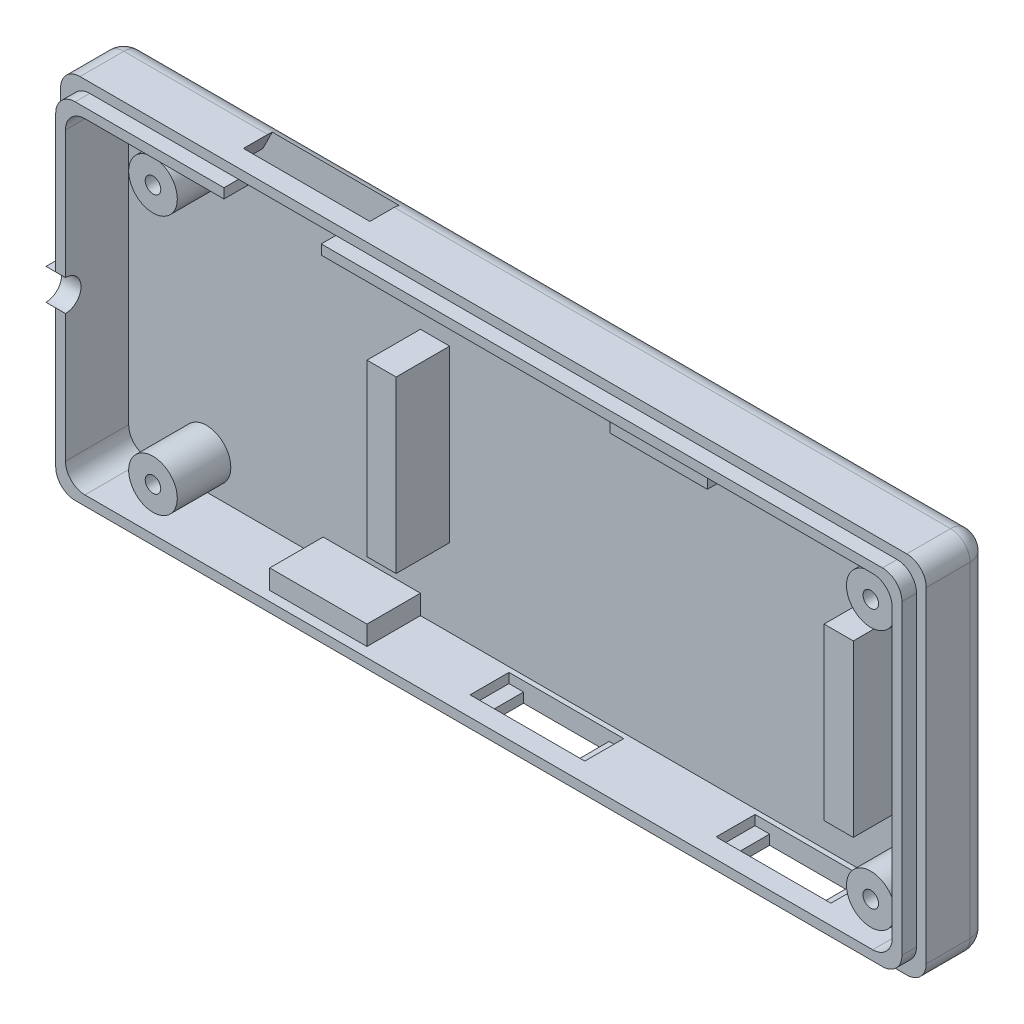
from build123d import *

# Parameters (mm, degrees)
SKETCH_1_W           = 89
SKETCH_1_H           = 37.5
EXTRUDE_1_DEPTH      = 8
SKETCH_2_W           = 85
SKETCH_2_H           = 33.5
CUT_EXTRUDE_1_DEPTH  = 6.5
FILLET_2_R           = 2
FILLET_3_R           = 2
FILLET_4_R           = 2
FILLET_5_R           = 2
FILLET_6_R           = 2
FILLET_7_R           = 2
SKETCH_3_R           = 2.5
SKETCH_3_W           = 10
SKETCH_3_H           = 2
SKETCH_3_W_2         = 3
SKETCH_3_H_2         = 17.5
EXTRUDE_2_DEPTH      = 5.5
SKETCH_4_R           = 0.8
CUT_EXTRUDE_2_DEPTH  = 97.831038412
SKETCH_5_R           = 0.8
CUT_EXTRUDE_3_DEPTH  = 97.831038412
SKETCH_6_R           = 0.8
CUT_EXTRUDE_4_DEPTH  = 97.831038412
SKETCH_8_R           = 0.8
CUT_EXTRUDE_5_DEPTH  = 97.831038412
SKETCH_9_R           = 2
CUT_EXTRUDE_6_DEPTH  = 1
CUT_EXTRUDE_7_DEPTH  = 2
SKETCH_11_W          = 8.8
SKETCH_11_H          = 4
CUT_EXTRUDE_8_DEPTH  = 2
SKETCH_12_W          = 11.8
SKETCH_12_H          = 4
CUT_EXTRUDE_9_DEPTH  = 1
CUT_EXTRUDE_10_DEPTH = 6.5
EXTRUDE_3_DEPTH      = 3.5
CUT_EXTRUDE_START    = -1.5
CUT_EXTRUDE_12_DEPTH = 1.5
SKETCH_18_W          = 10
SKETCH_18_H          = 3.5
CUT_EXTRUDE_15_DEPTH = 1


with BuildPart() as part:
    # 草图1 → 凸台-拉伸1 (new body)
    with BuildSketch(Plane.XY):
        with Locations((44.5, -18.75)):
            Rectangle(SKETCH_1_W, SKETCH_1_H)
    extrude(amount=EXTRUDE_1_DEPTH)

    # 草图2 → 切除-拉伸1 (cut)
    with BuildSketch(Plane.XY.offset(8)):
        with Locations((44.5, -18.75)):
            Rectangle(SKETCH_2_W, SKETCH_2_H)
    extrude(amount=-CUT_EXTRUDE_1_DEPTH, mode=Mode.SUBTRACT)

    # 圆角2
    fillet_2_edges = [part.edges().sort_by_distance(p)[0] for p in [
        (44.5, 0, 0),
        (89, -18.75, 0),
        (44.5, -37.5, 0),
        (0, -18.75, 0),
    ]]
    fillet(fillet_2_edges, radius=FILLET_2_R)

    # 圆角3
    fillet_3_edges = [part.edges().sort_by_distance(p)[0] for p in [
        (87, -35.5, 4.75),
    ]]
    fillet(fillet_3_edges, radius=FILLET_3_R)

    # 圆角4
    fillet_4_edges = [part.edges().sort_by_distance(p)[0] for p in [
        (87, -2, 4.75),
    ]]
    fillet(fillet_4_edges, radius=FILLET_4_R)

    # 圆角5
    fillet_5_edges = [part.edges().sort_by_distance(p)[0] for p in [
        (2, -35.5, 4.75),
    ]]
    fillet(fillet_5_edges, radius=FILLET_5_R)

    # 圆角6
    fillet_6_edges = [part.edges().sort_by_distance(p)[0] for p in [
        (2, -2, 4.75),
    ]]
    fillet(fillet_6_edges, radius=FILLET_6_R)

    # 圆角7
    # the kernel refuses this fillet: 2 mm, written as the material it takes off along each edge
    with BuildSketch(Plane(origin=(2, -2, 2), x_dir=(-1, 0, 0), z_dir=(0, 1, 0))) as fillet_7_piece_1_section:
        Polygon((0, 0), (FILLET_7_R, 0), (FILLET_7_R, -FILLET_7_R), (0, -FILLET_7_R), align=None)
    fillet_7_piece_1 = extrude(amount=FILLET_7_R, mode=Mode.PRIVATE)
    fillet_7_piece_1 = fillet_7_piece_1 - Plane(origin=(2, -2, 2), x_dir=(0.7071067811865475, 0, 0.7071067811865475), z_dir=(0, 1, 0)) * Sphere(FILLET_7_R, mode=Mode.PRIVATE)
    add(fillet_7_piece_1, mode=Mode.SUBTRACT)
    with BuildSketch(Plane(origin=(87, -2, 2), x_dir=(1, 0, 0), z_dir=(0, 1, 0))) as fillet_7_piece_2_section:
        Polygon((0, 0), (FILLET_7_R, 0), (FILLET_7_R, FILLET_7_R), (0, FILLET_7_R), align=None)
    fillet_7_piece_2 = extrude(amount=FILLET_7_R, mode=Mode.PRIVATE)
    fillet_7_piece_2 = fillet_7_piece_2 - Plane(origin=(87, -2, 2), x_dir=(-0.7071067811865475, 0, 0.7071067811865475), z_dir=(0, 1, 0)) * Sphere(FILLET_7_R, mode=Mode.PRIVATE)
    add(fillet_7_piece_2, mode=Mode.SUBTRACT)
    with BuildSketch(Plane(origin=(2, -35.5, 2), x_dir=(0, -1, 0), z_dir=(-1, 0, 0))) as fillet_7_piece_3_section:
        Polygon((0, 0), (FILLET_7_R, 0), (FILLET_7_R, -FILLET_7_R), (0, -FILLET_7_R), align=None)
    fillet_7_piece_3 = extrude(amount=FILLET_7_R, mode=Mode.PRIVATE)
    fillet_7_piece_3 = fillet_7_piece_3 - Plane(origin=(2, -35.5, 2), x_dir=(0, 0.7071067811865475, 0.7071067811865475), z_dir=(-1, 0, 0)) * Sphere(FILLET_7_R, mode=Mode.PRIVATE)
    add(fillet_7_piece_3, mode=Mode.SUBTRACT)
    with BuildSketch(Plane(origin=(87, -35.5, 2), x_dir=(0, -1, 0), z_dir=(1, 0, 0))) as fillet_7_piece_4_section:
        Polygon((0, 0), (FILLET_7_R, 0), (FILLET_7_R, FILLET_7_R), (0, FILLET_7_R), align=None)
    fillet_7_piece_4 = extrude(amount=FILLET_7_R, mode=Mode.PRIVATE)
    fillet_7_piece_4 = fillet_7_piece_4 - Plane(origin=(87, -35.5, 2), x_dir=(0, 0.7071067811865475, 0.7071067811865475), z_dir=(1, 0, 0)) * Sphere(FILLET_7_R, mode=Mode.PRIVATE)
    add(fillet_7_piece_4, mode=Mode.SUBTRACT)
    with BuildSketch(Plane(origin=(0, 0, 2), x_dir=(1, 0, 0), z_dir=(0, 0, 1)), Plane(origin=(0, -37.5, 2), x_dir=(0, 1, 0), z_dir=(0, 0, 1))) as fillet_7_piece_5:
        with BuildLine():
            CenterArc((FILLET_7_R, -FILLET_7_R), FILLET_7_R, 90, 90)
            Line((0, -FILLET_7_R), (0, 0))
            Line((0, 0), (FILLET_7_R, 0))
        make_face()
    extrude(amount=11, mode=Mode.SUBTRACT)
    with BuildSketch(Plane(origin=(89, 0, 2), x_dir=(-1, 0, 0), z_dir=(0, 0, 1)), Plane(origin=(89, -37.5, 2), x_dir=(0, 1, 0), z_dir=(0, 0, 1))) as fillet_7_piece_6:
        with BuildLine():
            CenterArc((FILLET_7_R, FILLET_7_R), FILLET_7_R, 180, 90)
            Line((0, FILLET_7_R), (0, 0))
            Line((0, 0), (FILLET_7_R, 0))
        make_face()
    extrude(amount=11, mode=Mode.SUBTRACT)

    # 草图3 → 凸台-拉伸2 (add)
    with BuildSketch(Plane.XY.offset(1.5)):
        with Locations((83.8, -5.4)):
            Circle(SKETCH_3_R)
        with Locations((83.8, -32.1)):
            Circle(SKETCH_3_R)
        with Locations((10, -5.4)):
            Circle(SKETCH_3_R)
        with Locations((10, -32.053618844)):
            Circle(SKETCH_3_R)
        with Locations((62, -3)):
            Rectangle(SKETCH_3_W, SKETCH_3_H)
        with Locations((27, -34.5)):
            Rectangle(SKETCH_3_W, SKETCH_3_H)
        with Locations((80.5, -18.75)):
            Rectangle(SKETCH_3_W_2, SKETCH_3_H_2)
        with Locations((33.5, -18.75)):
            Rectangle(SKETCH_3_W_2, SKETCH_3_H_2)
    extrude(amount=EXTRUDE_2_DEPTH)

    # 草图4 → 切除-拉伸2 (cut, through all)
    with BuildSketch(Plane.XY.offset(7)):
        with Locations((10, -5.4)):
            Circle(SKETCH_4_R)
    extrude(amount=-CUT_EXTRUDE_2_DEPTH, mode=Mode.SUBTRACT)

    # 草图5 → 切除-拉伸3 (cut, through all)
    with BuildSketch(Plane.XY.offset(7)):
        with Locations((83.8, -5.4)):
            Circle(SKETCH_5_R)
    extrude(amount=-CUT_EXTRUDE_3_DEPTH, mode=Mode.SUBTRACT)

    # 草图6 → 切除-拉伸4 (cut, through all)
    with BuildSketch(Plane.XY.offset(7)):
        with Locations((10, -32.053618844)):
            Circle(SKETCH_6_R)
    extrude(amount=-CUT_EXTRUDE_4_DEPTH, mode=Mode.SUBTRACT)

    # 草图8 → 切除-拉伸5 (cut, through all)
    with BuildSketch(Plane.XY.offset(7)):
        with Locations((83.8, -32.1)):
            Circle(SKETCH_8_R)
    extrude(amount=-CUT_EXTRUDE_5_DEPTH, mode=Mode.SUBTRACT)

    # 草图9 → 切除-拉伸6 (cut)
    with BuildSketch(Plane(origin=(0, 0, 0), x_dir=(-1, 0, 0), z_dir=(0, 0, -1))):
        with Locations((-83.8, -5.4)):
            Circle(SKETCH_9_R)
        with Locations((-10, -5.4)):
            Circle(SKETCH_9_R)
        with Locations((-10, -32.053618844)):
            Circle(SKETCH_9_R)
        with Locations((-83.8, -32.1)):
            Circle(SKETCH_9_R)
    extrude(amount=-CUT_EXTRUDE_6_DEPTH, mode=Mode.SUBTRACT)

    # 草图10 → 切除-拉伸7 (cut)
    with BuildSketch(Plane.ZY):
        with BuildLine():
            Line((8, -17.15), (8, -20.35))
            ThreePointArc((8, -20.35), (6.4, -18.75), (8, -17.15))
        make_face()
    extrude(amount=-CUT_EXTRUDE_7_DEPTH, mode=Mode.SUBTRACT)

    # 草图11 → 切除-拉伸8 (cut)
    with BuildSketch(Plane.XZ.offset(37.5)):
        with Locations((72.8, 4)):
            Rectangle(SKETCH_11_W, SKETCH_11_H)
        with Locations((47.5, 4)):
            Rectangle(SKETCH_11_W, SKETCH_11_H)
    extrude(amount=-CUT_EXTRUDE_8_DEPTH, mode=Mode.SUBTRACT)

    # 草图12 → 切除-拉伸9 (cut)
    with BuildSketch(Plane(origin=(0, -35.5, 0), x_dir=(1, 0, 0), z_dir=(0, 1, 0))):
        with Locations((72.8, -4)):
            Rectangle(SKETCH_12_W, SKETCH_12_H)
        with Locations((47.5, -4)):
            Rectangle(SKETCH_12_W, SKETCH_12_H)
    extrude(amount=-CUT_EXTRUDE_9_DEPTH, mode=Mode.SUBTRACT)

    # 草图13 → 切除-拉伸10 (cut)
    with BuildSketch(Plane.XY.offset(8)):
        Polygon((29.8, 0), (30.8, -2), (15.8, -2), (16.8, 0), align=None)
    extrude(amount=-CUT_EXTRUDE_10_DEPTH, mode=Mode.SUBTRACT)

    # 草图14 → 凸台-拉伸3 (add)
    with BuildSketch(Plane.XY.offset(8)):
        Polygon((15.8, -2), (16.8, 0), (29.8, 0), (30.8, -2), align=None)
    extrude(amount=-EXTRUDE_3_DEPTH)

    # 草图15 → 切除-拉伸12 (cut)
    with BuildSketch(Plane.XY.offset(8).offset(CUT_EXTRUDE_START)):
        with BuildLine():
            Line((2, 0), (87, 0))
            ThreePointArc((87, 0), (88.414213562, -0.585786438), (89, -2))
            Line((89, -2), (89, -35.5))
            ThreePointArc((89, -35.5), (88.414213562, -36.914213562), (87, -37.5))
            Line((87, -37.5), (2, -37.5))
            ThreePointArc((2, -37.5), (0.585786438, -36.914213562), (0, -35.5))
            Line((0, -35.5), (0, -20.35))
            Line((0, -20.35), (1, -20.35))
            Line((1, -20.35), (1, -34.5))
            ThreePointArc((1, -34.5), (1.585786438, -35.914213562), (3, -36.5))
            Line((3, -36.5), (86, -36.5))
            ThreePointArc((86, -36.5), (87.414213562, -35.914213562), (88, -34.5))
            Line((88, -34.5), (88, -3))
            ThreePointArc((88, -3), (87.414213562, -1.585786438), (86, -1))
            Line((86, -1), (3, -1))
            ThreePointArc((3, -1), (1.585786438, -1.585786438), (1, -3))
            Line((1, -3), (1, -17.15))
            Line((1, -17.15), (0, -17.15))
            Line((0, -17.15), (0, -2))
            ThreePointArc((0, -2), (0.585786438, -0.585786438), (2, 0))
        make_face()
    extrude(amount=CUT_EXTRUDE_12_DEPTH, mode=Mode.SUBTRACT)

    # 草图18 → 切除-拉伸15 (cut)
    with BuildSketch(Plane(origin=(0, -2, 0), x_dir=(-1, 0, 0), z_dir=(0, -1, 0))):
        with Locations((-23.3, -6.25)):
            Rectangle(SKETCH_18_W, SKETCH_18_H)
    extrude(amount=-CUT_EXTRUDE_15_DEPTH, mode=Mode.SUBTRACT)


solid = part.part
